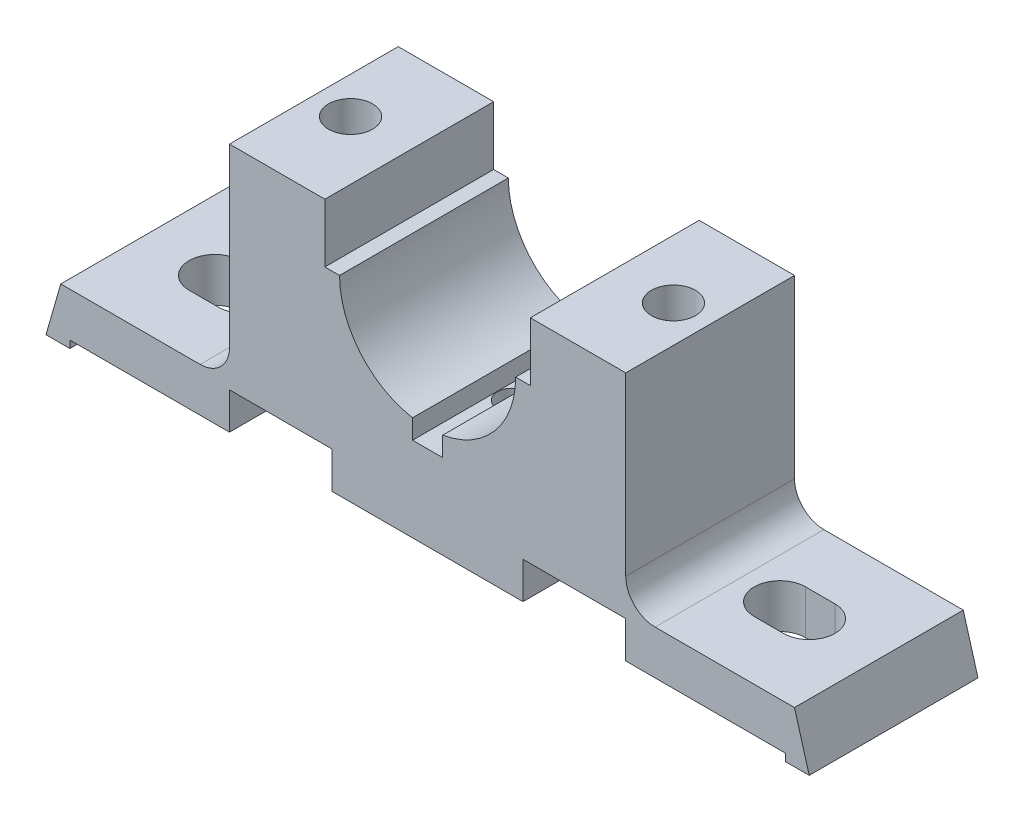
from build123d import *
from OCP.BRepAlgoAPI import BRepAlgoAPI_Cut
from OCP.TopTools import TopTools_ListOfShape

# Parameters (mm, degrees)
BOSS_EXTRUDE1_DEPTH     = 23
CUT_EXTRUDE1_DEPTH      = 120.419428905
CUT_EXTRUDE1_DEPTH_BACK = 120.419428905
SKETCH2_R               = 6
CUT_EXTRUDE4_START      = -28.953391
SKETCH2_3_R             = 4
CUT_EXTRUDE4_DEPTH      = 8


with BuildPart() as part:
    # Sketch1 → Boss-Extrude1 (new, symmetric)
    with BuildSketch(Plane.XY):
        with BuildLine():
            ThreePointArc((-4.105081288, -23.646316999), (-18.364666495, -15.451181979), (-24, 0))
            Line((-24, 0), (-28, 0))
            Line((-28, 0), (-28, 16))
            Line((-28, 16), (-54, 16))
            Line((-54, 16), (-54, -32))
            ThreePointArc((-54, -32), (-56.343145751, -37.656854249), (-62, -40))
            Line((-62, -40), (-99.985564599, -40))
            Line((-99.985564599, -40), (-104, -54))
            Line((-104, -54), (-97.5, -54))
            Line((-97.5, -54), (-97.5, -52))
            Line((-97.5, -52), (-59.034606353, -52))
            Line((-59.034606353, -52), (-54, -52))
            Line((-54, -52), (-54, -42))
            Line((-54, -42), (-26, -42))
            Line((-26, -42), (-26, -52))
            Line((-26, -52), (26, -52))
            Line((26, -52), (26, -42))
            Line((26, -42), (54, -42))
            Line((54, -42), (54, -52))
            Line((54, -52), (97.5, -52))
            Line((97.5, -52), (97.5, -54))
            Line((97.5, -54), (104, -54))
            Line((104, -54), (99.985564599, -40))
            Line((99.985564599, -40), (62, -40))
            ThreePointArc((62, -40), (56.343145751, -37.656854249), (54, -32))
            Line((54, -32), (54, 16))
            Line((54, 16), (28, 16))
            Line((28, 16), (28, 0))
            Line((28, 0), (24, 0))
            ThreePointArc((24, 0), (18.364666495, -15.451181979), (4.105081288, -23.646316999))
            Line((4.105081288, -23.646316999), (4.105081288, -28.953390601))
            Line((4.105081288, -28.953390601), (-4.105081288, -28.953390601))
            Line((-4.105081288, -28.953390601), (-4.105081288, -23.646316999))
        make_face()
    extrude(amount=BOSS_EXTRUDE1_DEPTH, both=True)

    # Sketch2 → Cut-Extrude1 (cut, two sides: drawn at the far end of the back side and taken through both)
    with BuildSketch(Plane(origin=(0, 0, 0), x_dir=(1, 0, 0), z_dir=(0, 1, 0)).offset(-CUT_EXTRUDE1_DEPTH_BACK)):
        with BuildLine():
            Line((-81, -7), (-73, -7))
            ThreePointArc((-73, -7), (-66, 0), (-73, 7))
            Line((-73, 7), (-81, 7))
            ThreePointArc((-81, 7), (-88, 0), (-81, -7))
        make_face()
        with BuildLine():
            ThreePointArc((73, -7), (66, 0), (73, 7))
            Line((73, 7), (81, 7))
            ThreePointArc((81, 7), (88, 0), (81, -7))
            Line((81, -7), (73, -7))
        make_face()
        with Locations(Location((44, 0, 0), (0, 0, 270))):
            Circle(SKETCH2_R)
        with Locations(Location((-44, 0, 0), (0, 0, 270))):
            Circle(SKETCH2_R)
    extrude(amount=CUT_EXTRUDE1_DEPTH + CUT_EXTRUDE1_DEPTH_BACK, mode=Mode.SUBTRACT)


with BuildPart() as cut_extrude4_tool:
    # Sketch2<3> → Cut-Extrude4 (new body)
    with BuildSketch(Plane(origin=(0, 0, 0), x_dir=(1, 0, 0), z_dir=(0, 1, 0)).offset(CUT_EXTRUDE4_START)):
        with Locations(Location((0, 0, 0), (0, 0, 270))):
            Circle(SKETCH2_3_R)
    extrude(amount=-CUT_EXTRUDE4_DEPTH)


with BuildPart() as part_1:
    add(part.part)

    # Cut-Extrude4: cut by cut_extrude4_tool, with a tolerance
    cut_extrude4_stock = TopTools_ListOfShape()
    cut_extrude4_stock.Append(part_1.part.wrapped)
    cut_extrude4_tools = TopTools_ListOfShape()
    cut_extrude4_tools.Append(cut_extrude4_tool.part.wrapped)
    cut_extrude4_cut = BRepAlgoAPI_Cut()
    cut_extrude4_cut.SetArguments(cut_extrude4_stock)
    cut_extrude4_cut.SetTools(cut_extrude4_tools)
    cut_extrude4_cut.SetFuzzyValue(0.00001)
    cut_extrude4_cut.Build()
    add(Compound.cast(cut_extrude4_cut.Shape()).solids(), mode=Mode.REPLACE)


solid = part_1.part
